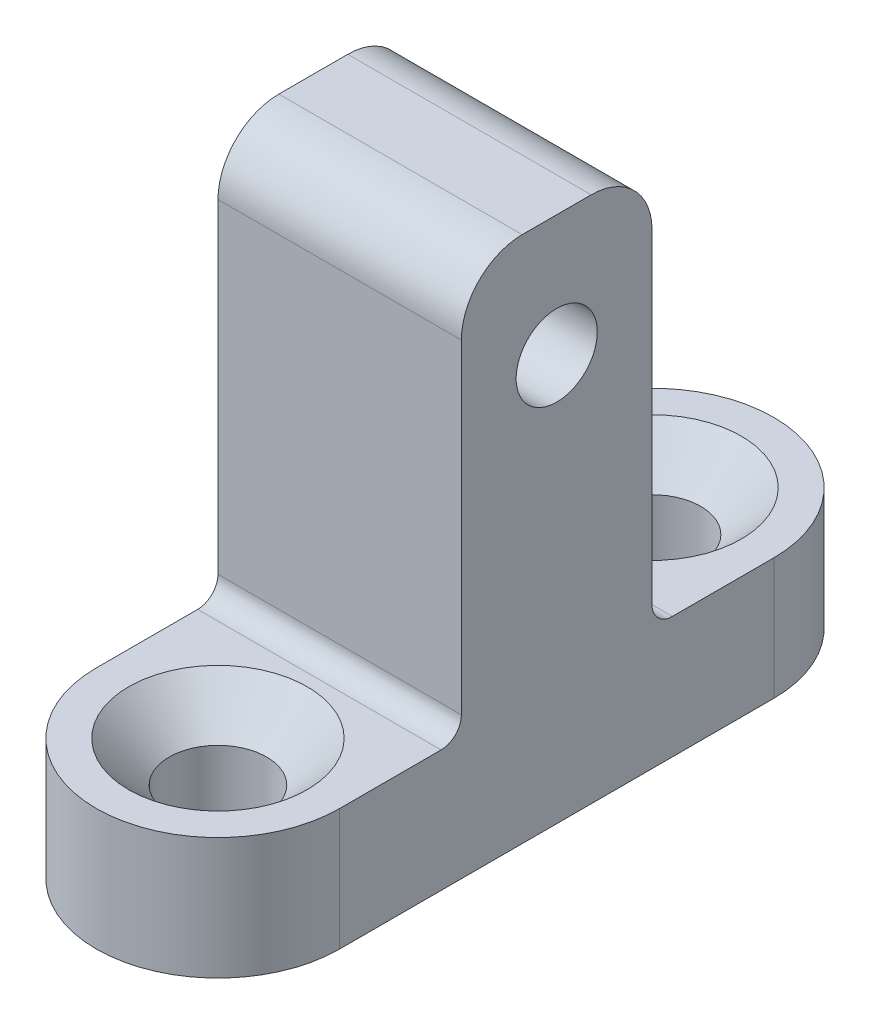
from build123d import *

# Parameters (mm, degrees)
CROQUIS1_W                   = 3
CROQUIS1_H                   = 4.7
SALIENTE_EXTRUIR1_DEPTH      = 13
SALIENTE_EXTRUIR2_DEPTH      = 3
CORTAR_EXTRUIR1_DEPTH        = 17.5747549
CORTAR_EXTRUIR1_DEPTH_BACK   = 17.5747549
CROQUIS2_R                   = 1
REDONDEO1_R                  = 0.5
TALADROAVANZADO1_OUTLINE_R   = 1.2
TALADROAVANZADO1_DEPTH       = 1
TALADROAVANZADO1_DRAFT       = -45
TALADROAVANZADO1_2_OUTLINE_R = 1.2
TALADROAVANZADO1_2_DEPTH     = 1
TALADROAVANZADO1_2_DRAFT     = -45
REDONDEO2_R                  = 1.5
CORTAR_EXTRUIR2_REACH        = 16.132
CROQUIS4_R                   = 1.2


# Read off the part's stored shape, not the designer's step: TaladroAvanzado1
with BuildPart() as part:
    # Croquis1 → Saliente-Extruir1 (new body)
    with BuildSketch(Plane(origin=(0, 0, 0), x_dir=(1, 0, 0), z_dir=(0, 1, 0))):
        with Locations((-1.5, 0)):
            Rectangle(CROQUIS1_W, CROQUIS1_H)
        with Locations((1.5, 0)):
            Rectangle(CROQUIS1_W, CROQUIS1_H)
    extrude(amount=SALIENTE_EXTRUIR1_DEPTH)

    # Croquis1<3> → Saliente-Extruir2 (add)
    with BuildSketch(Plane(origin=(0, 0, 0), x_dir=(1, 0, 0), z_dir=(0, 1, 0))):
        with BuildLine():
            Line((3, 2.35), (3, 5.35))
            ThreePointArc((3, 5.35), (0, 8.35), (-3, 5.35))
            Line((-3, 5.35), (-3, 2.35))
            Line((-3, 2.35), (3, 2.35))
        make_face()
        with BuildLine():
            Line((3, -5.35), (3, -2.35))
            Line((3, -2.35), (-3, -2.35))
            Line((-3, -2.35), (-3, -5.35))
            ThreePointArc((-3, -5.35), (0, -8.35), (3, -5.35))
        make_face()
    extrude(amount=SALIENTE_EXTRUIR2_DEPTH)

    # Croquis2 → Cortar-Extruir1 (cut, two sides: drawn at the far end of the back side and taken through both)
    with BuildSketch(Plane(origin=(3, 0, 0), x_dir=(0, 0, -1), z_dir=(1, 0, 0)).offset(-CORTAR_EXTRUIR1_DEPTH_BACK)):
        with Locations((0, 10)):
            Circle(CROQUIS2_R)
    extrude(amount=CORTAR_EXTRUIR1_DEPTH + CORTAR_EXTRUIR1_DEPTH_BACK, mode=Mode.SUBTRACT)

    # Redondeo1
    redondeo1_edges = [part.edges().sort_by_distance(p)[0] for p in [
        (0, 3, 2.35),
        (0, 3, -2.35),
    ]]
    fillet(redondeo1_edges, radius=REDONDEO1_R)


with BuildPart() as taladroavanzado1_tool:
    # TaladroAvanzado1 outline → TaladroAvanzado1 (with draft: the straight prism first)
    with BuildSketch(Plane(origin=(0, 2, 0), x_dir=(1, 0, 0), z_dir=(0, 1, 0))):
        with Locations((0, 5.35)):
            Circle(TALADROAVANZADO1_OUTLINE_R)
    extrude(amount=TALADROAVANZADO1_DEPTH)
    # TaladroAvanzado1: the draft: its side faces are tilted about the plane it starts from
    taladroavanzado1_sides = [taladroavanzado1_tool.faces().sort_by_distance(p)[0] for p in [
        (-1.2, 2.5, -5.35),
    ]]
    draft(taladroavanzado1_sides, Plane(origin=(0, 2, 0), x_dir=(1, 0, 0), z_dir=(0, 1, 0)), TALADROAVANZADO1_DRAFT)


with BuildPart() as part_1:
    add(part.part)

    # TaladroAvanzado1: cut by taladroavanzado1_tool
    add(taladroavanzado1_tool.part, mode=Mode.SUBTRACT)


with BuildPart() as taladroavanzado1_2_tool:
    # TaladroAvanzado1 2 outline → TaladroAvanzado1 2 (with draft: the straight prism first)
    with BuildSketch(Plane(origin=(0, 2, 0), x_dir=(1, 0, 0), z_dir=(0, 1, 0))):
        with Locations((0, -5.35)):
            Circle(TALADROAVANZADO1_2_OUTLINE_R)
    extrude(amount=TALADROAVANZADO1_2_DEPTH)
    # TaladroAvanzado1 2: the draft: its side faces are tilted about the plane it starts from
    taladroavanzado1_2_sides = [taladroavanzado1_2_tool.faces().sort_by_distance(p)[0] for p in [
        (-1.2, 2.5, 5.35),
    ]]
    draft(taladroavanzado1_2_sides, Plane(origin=(0, 2, 0), x_dir=(1, 0, 0), z_dir=(0, 1, 0)), TALADROAVANZADO1_2_DRAFT)


with BuildPart() as part_2:
    add(part_1.part)

    # TaladroAvanzado1 2: cut by taladroavanzado1_2_tool
    add(taladroavanzado1_2_tool.part, mode=Mode.SUBTRACT)

    # Redondeo2
    redondeo2_edges = [part_2.edges().sort_by_distance(p)[0] for p in [
        (0, 13, -2.35),
        (0, 13, 2.35),
    ]]
    fillet(redondeo2_edges, radius=REDONDEO2_R)

    # Croquis4 → Cortar-Extruir2 (cut, up to next)
    with BuildSketch(Plane(origin=(0, 2, 0), x_dir=(1, 0, 0), z_dir=(0, 1, 0)), mode=Mode.PRIVATE) as cortar_extruir2_sk1:
        with Locations(Location((0, -5.35, 0), (0, 0, 270))):
            Circle(CROQUIS4_R)
    cortar_extruir2_tool1 = extrude(cortar_extruir2_sk1.sketch, amount=-CORTAR_EXTRUIR2_REACH, mode=Mode.PRIVATE) & part_2.part
    # Croquis4 → Cortar-Extruir2 (cut, up to next)
    with BuildSketch(Plane(origin=(0, 2, 0), x_dir=(1, 0, 0), z_dir=(0, 1, 0)), mode=Mode.PRIVATE) as cortar_extruir2_sk2:
        with Locations(Location((0, 5.35, 0), (0, 0, 270))):
            Circle(CROQUIS4_R)
    cortar_extruir2_tool2 = extrude(cortar_extruir2_sk2.sketch, amount=-CORTAR_EXTRUIR2_REACH, mode=Mode.PRIVATE) & part_2.part
    add(cortar_extruir2_tool1.solids().sort_by_distance((0, 2, 5.35))[0], mode=Mode.SUBTRACT)
    add(cortar_extruir2_tool2.solids().sort_by_distance((0, 2, -5.35))[0], mode=Mode.SUBTRACT)


solid = part_2.part
